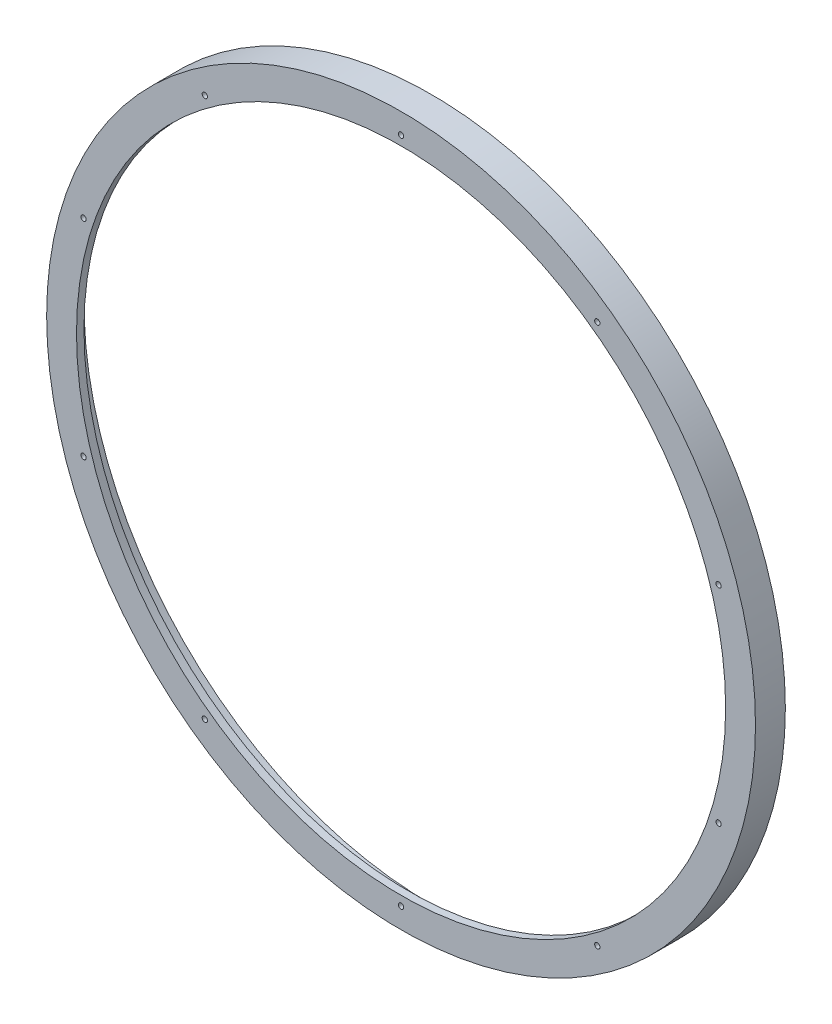
from build123d import *

# Parameters (mm, degrees)
F_4_40_TAPPED_HOLE1_D = 2.2606
CIRPATTERN1_COUNT     = 10


with BuildPart() as part:
    # Sketch1 → Revolve1 (revolve)
    with BuildSketch(Plane(origin=(0, 0, 0), x_dir=(0, 0, -1), z_dir=(1, 0, 0))):
        Polygon((3.175, 147.574), (12.7, 147.574), (12.7, 150.749), (0, 150.749), (0, 138.049), (3.175, 138.049), align=None)
    revolve(axis=Axis((0, 0, 0), (0, 0, -1)))

    # #4-40 Tapped Hole1 (through all)
    with Locations(Plane.XY):
        with Locations((0, 142)):
            f_4_40_tapped_hole1 = Hole(F_4_40_TAPPED_HOLE1_D / 2)

    # CirPattern1: #4-40 Tapped Hole1 ×10 about axis
    cirpattern1_axis = Axis((0, 0, 0), (0, 0, 1))
    for i in range(1, CIRPATTERN1_COUNT):
        add(f_4_40_tapped_hole1.rotate(cirpattern1_axis, i * 360 / CIRPATTERN1_COUNT), mode=Mode.SUBTRACT)


solid = part.part
